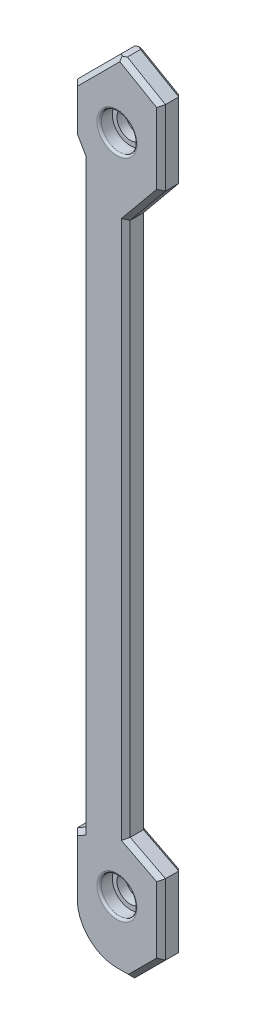
from build123d import *

# Parameters (mm, degrees)
SKETCH_1_W          = 20
SKETCH_1_H          = 180
SKETCH_1_R          = 3
EXTRUDE_1_DEPTH     = 5
SKETCH_2_R          = 4.05
CUT_EXTRUDE_1_DEPTH = 3
CHAMFER_1_SIZE      = 10
CHAMFER_2_SIZE      = 5
CHAMFER_2_SIZE2     = 8.660254038
CUT_EXTRUDE_2_DEPTH = 10
FILLET_1_R          = 10
CHAMFER_3_SIZE      = 7
CHAMFER_5_SIZE      = 1
CUT_EXTRUDE_3_DEPTH = 10
CHAMFER_6_SIZE      = 1
FILLET_2_R          = 0.5
FILLET_3_R          = 0.5


with BuildPart() as part:
    # 草图1 → 凸台-拉伸1 (new body)
    with BuildSketch(Plane.XY):
        Rectangle(SKETCH_1_W, SKETCH_1_H)
        with Locations((0, -75)):
            Circle(SKETCH_1_R, mode=Mode.SUBTRACT)
        with Locations((0, 75)):
            Circle(SKETCH_1_R, mode=Mode.SUBTRACT)
    extrude(amount=EXTRUDE_1_DEPTH)

    # 草图2 → 切除-拉伸1 (cut)
    with BuildSketch(Plane.XY.offset(5)):
        with Locations((0, 75)):
            Circle(SKETCH_2_R)
        with Locations((0, -75)):
            Circle(SKETCH_2_R)
    extrude(amount=-CUT_EXTRUDE_1_DEPTH, mode=Mode.SUBTRACT)

    # 倒角1
    chamfer_1_edges = [part.edges().sort_by_distance(p)[0] for p in [
        (-10, 90, 2.5),
    ]]
    chamfer(chamfer_1_edges, length=CHAMFER_1_SIZE)

    # 倒角2
    chamfer_2_edges = [part.edges().sort_by_distance(p)[0] for p in [
        (10, 90, 2.5),
    ]]
    chamfer_2_side = [part.faces().sort_by_distance(p)[0] for p in [
        (10, 0, 2.5),
    ]]
    chamfer(chamfer_2_edges, length=CHAMFER_2_SIZE, length2=CHAMFER_2_SIZE2, reference=chamfer_2_side[0])

    # 草图3 → 切除-拉伸2 (cut)
    with BuildSketch(Plane.XY.offset(5)):
        Polygon((10, 68), (2, 58.268253796), (2, -62.880981993), (10, -67), align=None)
    extrude(amount=-CUT_EXTRUDE_2_DEPTH, mode=Mode.SUBTRACT)

    # 圆角1
    fillet_1_edges = [part.edges().sort_by_distance(p)[0] for p in [
        (-10, -90, 2.5),
    ]]
    fillet(fillet_1_edges, radius=FILLET_1_R)

    # 倒角3
    chamfer_3_edges = [part.edges().sort_by_distance(p)[0] for p in [
        (10, -90, 2.5),
    ]]
    chamfer(chamfer_3_edges, length=CHAMFER_3_SIZE)

    # 倒角5
    # the kernel refuses this chamfer: 1 mm, written as the material it takes off along each edge
    with BuildSketch(Plane(origin=(-11.81845448, 78.18154552, 0), x_dir=(0.7068394360706736, -0.7068394360706736, -0.02749587661058609), z_dir=(0.7071067811865476, 0.7071067811865476, 0)), Plane(origin=(-11.81845448, 78.18154552, 5), x_dir=(-0.019442520806012064, 0.019442520806012064, -0.9996219169112968), z_dir=(0.7071067811865476, 0.7071067811865476, 0))) as chamfer_5_piece_1:
        Polygon((CHAMFER_5_SIZE * 0.999621916911, -CHAMFER_5_SIZE * 0.0274958766106), (-CHAMFER_5_SIZE * 0.0274958766106, -CHAMFER_5_SIZE * 0.999621916911), (0, 0), align=None)
    extrude(amount=19.2855016, mode=Mode.SUBTRACT)
    with BuildSketch(Plane(origin=(12.227142798, 83.714158506, 0), x_dir=(-0.49981095845564655, -0.8656979742248815, -0.02749587661058648), z_dir=(-0.8660254037844397, 0.49999999999999817, 0)), Plane(origin=(12.227142798, 83.714158506, 5), x_dir=(0.013747938305290464, 0.02381212764408557, -0.999621916911297), z_dir=(-0.8660254037844397, 0.49999999999999817, 0))) as chamfer_5_piece_2:
        Polygon((CHAMFER_5_SIZE * 0.999621916911, CHAMFER_5_SIZE * 0.0274958766106), (-CHAMFER_5_SIZE * 0.0274958766106, CHAMFER_5_SIZE * 0.999621916911), (0, 0), align=None)
    extrude(amount=15.143365976, mode=Mode.SUBTRACT)
    with BuildSketch(Plane(origin=(1.18154552, -91.81845448, 0), x_dir=(-0.7068394360706736, 0.7068394360706735, -0.027495876610586254), z_dir=(0.7071067811865476, 0.7071067811865476, 0)), Plane(origin=(1.18154552, -91.81845448, 5), x_dir=(0.01944252080601271, -0.01944252080601271, -0.9996219169112968), z_dir=(0.7071067811865476, 0.7071067811865476, 0))) as chamfer_5_piece_3:
        Polygon((CHAMFER_5_SIZE * 0.999621916911, CHAMFER_5_SIZE * 0.0274958766106), (-CHAMFER_5_SIZE * 0.0274958766106, CHAMFER_5_SIZE * 0.999621916911), (0, 0), align=None)
    extrude(amount=15.042860913, mode=Mode.SUBTRACT)
    with BuildSketch(Plane(origin=(10, -85.571682988, 0), x_dir=(-0.9996219169112968, 0, -0.02749587661058639), z_dir=(0, 1, 0)), Plane(origin=(10, -85.571682988, 5), x_dir=(0.027495876610585623, 0, -0.9996219169112968), z_dir=(0, 1, 0))) as chamfer_5_piece_4:
        Polygon((CHAMFER_5_SIZE * 0.999621916911, CHAMFER_5_SIZE * 0.0274958766106), (-CHAMFER_5_SIZE * 0.0274958766106, CHAMFER_5_SIZE * 0.999621916911), (0, 0), align=None)
    extrude(amount=21.143365976, mode=Mode.SUBTRACT)
    with BuildSketch(Plane(origin=(-0.286415982, -61.703758417, 0), x_dir=(-0.4575908043726023, -0.8887376623745898, -0.027495876610586185), z_dir=(0.8890738061453024, -0.4577638771531731, 0))) as chamfer_5_piece_5_section:
        Polygon((CHAMFER_5_SIZE * 0.999621916911, -CHAMFER_5_SIZE * 0.0274958766106), (-CHAMFER_5_SIZE * 0.0274958766106, -CHAMFER_5_SIZE * 0.999621916911), (0, 0), align=None)
    chamfer_5_piece_5 = extrude(amount=14.141494078, mode=Mode.PRIVATE)
    chamfer_5_piece_5 = split(chamfer_5_piece_5, bisect_by=Plane(origin=(2, -65.858290637, 0.331326909), z_dir=(1, 0, 0)), keep=Keep.TOP, mode=Mode.PRIVATE)
    add(chamfer_5_piece_5, mode=Mode.SUBTRACT)
    with BuildSketch(Plane(origin=(10, 65.428317012, 0), x_dir=(-0.9996219169112968, 0, -0.02749587661058639), z_dir=(0, 1, 0)), Plane(origin=(10, 65.428317012, 5), x_dir=(0.027495876610585623, 0, -0.9996219169112968), z_dir=(0, 1, 0))) as chamfer_5_piece_6:
        Polygon((CHAMFER_5_SIZE * 0.999621916911, CHAMFER_5_SIZE * 0.0274958766106), (-CHAMFER_5_SIZE * 0.0274958766106, CHAMFER_5_SIZE * 0.999621916911), (0, 0), align=None)
    extrude(amount=22.143365976, mode=Mode.SUBTRACT)
    with BuildSketch(Plane(origin=(11.633087807, 69.986599508, 0), x_dir=(-0.7721979799806099, 0.6347867803312237, -0.02749587661058653), z_dir=(-0.6350268732528727, -0.7724900454029683, 0))) as chamfer_5_piece_7_section:
        Polygon((CHAMFER_5_SIZE * 0.999621916911, -CHAMFER_5_SIZE * 0.0274958766106), (-CHAMFER_5_SIZE * 0.0274958766106, -CHAMFER_5_SIZE * 0.999621916911), (0, 0), align=None)
    chamfer_5_piece_7 = extrude(amount=17.741258029, mode=Mode.PRIVATE)
    chamfer_5_piece_7 = split(chamfer_5_piece_7, bisect_by=Plane(origin=(2, 64.486030302, 0.332589974), z_dir=(1, 0, 0)), keep=Keep.TOP, mode=Mode.PRIVATE)
    add(chamfer_5_piece_7, mode=Mode.SUBTRACT)
    with BuildSketch(Plane(origin=(2, 60.839936784, 0), x_dir=(-0.9996219169112968, 0, -0.027495876610586365), z_dir=(0, -1, 0))) as chamfer_5_piece_8_section:
        Polygon((CHAMFER_5_SIZE * 0.999621916911, -CHAMFER_5_SIZE * 0.0274958766106), (-CHAMFER_5_SIZE * 0.0274958766106, -CHAMFER_5_SIZE * 0.999621916911), (0, 0), align=None)
    chamfer_5_piece_8 = extrude(amount=126.292601765, mode=Mode.PRIVATE)
    chamfer_5_piece_8 = split(chamfer_5_piece_8, bisect_by=Plane(origin=(-22.866025016, -50.078031392, 0.330281086), z_dir=(0.4577638771531731, 0.8890738061453024, 0)), keep=Keep.TOP, mode=Mode.PRIVATE)
    chamfer_5_piece_8 = split(chamfer_5_piece_8, bisect_by=Plane(origin=(-27.904215912, 21.890723836, 0.330281086), z_dir=(0.7724900454029683, -0.6350268732528727, 0)), keep=Keep.TOP, mode=Mode.PRIVATE)
    add(chamfer_5_piece_8, mode=Mode.SUBTRACT)
    with BuildSketch(Plane(origin=(-0.286415982, -61.703758417, 5), x_dir=(0.012586619082987256, 0.024445863671475603, -0.9996219169112968), z_dir=(0.8890738061453024, -0.4577638771531731, 0))) as chamfer_5_piece_9_section:
        Polygon((CHAMFER_5_SIZE * 0.999621916911, -CHAMFER_5_SIZE * 0.0274958766106), (-CHAMFER_5_SIZE * 0.0274958766106, -CHAMFER_5_SIZE * 0.999621916911), (0, 0), align=None)
    chamfer_5_piece_9 = extrude(amount=14.141494078, mode=Mode.PRIVATE)
    chamfer_5_piece_9 = split(chamfer_5_piece_9, bisect_by=Plane(origin=(2, -65.858290637, 4.668673091), z_dir=(1, 0, 0)), keep=Keep.TOP, mode=Mode.PRIVATE)
    add(chamfer_5_piece_9, mode=Mode.SUBTRACT)
    with BuildSketch(Plane(origin=(11.633087807, 69.986599508, 5), x_dir=(0.02124029097130686, -0.017460620551367937, -0.9996219169112968), z_dir=(-0.6350268732528727, -0.7724900454029683, 0))) as chamfer_5_piece_10_section:
        Polygon((CHAMFER_5_SIZE * 0.999621916911, -CHAMFER_5_SIZE * 0.0274958766106), (-CHAMFER_5_SIZE * 0.0274958766106, -CHAMFER_5_SIZE * 0.999621916911), (0, 0), align=None)
    chamfer_5_piece_10 = extrude(amount=17.741258029, mode=Mode.PRIVATE)
    chamfer_5_piece_10 = split(chamfer_5_piece_10, bisect_by=Plane(origin=(2, 64.486030302, 4.667410026), z_dir=(1, 0, 0)), keep=Keep.TOP, mode=Mode.PRIVATE)
    add(chamfer_5_piece_10, mode=Mode.SUBTRACT)
    with BuildSketch(Plane(origin=(2, 60.839936784, 5), x_dir=(0.027495876610586487, 0, -0.9996219169112968), z_dir=(0, -1, 0))) as chamfer_5_piece_11_section:
        Polygon((CHAMFER_5_SIZE * 0.999621916911, -CHAMFER_5_SIZE * 0.0274958766106), (-CHAMFER_5_SIZE * 0.0274958766106, -CHAMFER_5_SIZE * 0.999621916911), (0, 0), align=None)
    chamfer_5_piece_11 = extrude(amount=126.292601765, mode=Mode.PRIVATE)
    chamfer_5_piece_11 = split(chamfer_5_piece_11, bisect_by=Plane(origin=(-22.866025016, -50.078031392, 4.669718914), z_dir=(0.4577638771531731, 0.8890738061453024, 0)), keep=Keep.TOP, mode=Mode.PRIVATE)
    chamfer_5_piece_11 = split(chamfer_5_piece_11, bisect_by=Plane(origin=(-27.904215912, 21.890723836, 4.669718914), z_dir=(0.7724900454029683, -0.6350268732528727, 0)), keep=Keep.TOP, mode=Mode.PRIVATE)
    add(chamfer_5_piece_11, mode=Mode.SUBTRACT)
    with BuildSketch(Plane(origin=(-0.286415982, -61.703758417, 0), x_dir=(-0.4575908043726023, -0.8887376623745898, -0.027495876610586185), z_dir=(0.8890738061453024, -0.4577638771531731, 0))) as chamfer_5_piece_12a_section:
        Polygon((CHAMFER_5_SIZE * 0.999621916911, -CHAMFER_5_SIZE * 0.0274958766106), (-CHAMFER_5_SIZE * 0.0274958766106, -CHAMFER_5_SIZE * 0.999621916911), (0, 0), align=None)
    chamfer_5_piece_12a = extrude(amount=14.141494078, mode=Mode.PRIVATE)
    chamfer_5_piece_12a = split(chamfer_5_piece_12a, bisect_by=Plane(origin=(2, -62.636454887, 0.323417731), z_dir=(-1, 0, 0)), keep=Keep.TOP, mode=Mode.PRIVATE)
    with BuildSketch(Plane(origin=(2, 60.839936784, 0), x_dir=(-0.9996219169112968, 0, -0.027495876610586365), z_dir=(0, -1, 0))) as chamfer_5_piece_12b_section:
        Polygon((CHAMFER_5_SIZE * 0.999621916911, -CHAMFER_5_SIZE * 0.0274958766106), (-CHAMFER_5_SIZE * 0.0274958766106, -CHAMFER_5_SIZE * 0.999621916911), (0, 0), align=None)
    chamfer_5_piece_12b = extrude(amount=126.292601765, mode=Mode.PRIVATE)
    chamfer_5_piece_12b = split(chamfer_5_piece_12b, bisect_by=Plane(origin=(2.217402645, -62.992917669, 0.323417731), z_dir=(-0.4577638771531731, -0.8890738061453024, 0)), keep=Keep.TOP, mode=Mode.PRIVATE)
    chamfer_5_piece_12 = chamfer_5_piece_12a & chamfer_5_piece_12b
    add(chamfer_5_piece_12, mode=Mode.SUBTRACT)
    with BuildSketch(Plane(origin=(2, 60.839936784, 0), x_dir=(-0.9996219169112968, 0, -0.027495876610586365), z_dir=(0, -1, 0))) as chamfer_5_piece_13a_section:
        Polygon((CHAMFER_5_SIZE * 0.999621916911, -CHAMFER_5_SIZE * 0.0274958766106), (-CHAMFER_5_SIZE * 0.0274958766106, -CHAMFER_5_SIZE * 0.999621916911), (0, 0), align=None)
    chamfer_5_piece_13a = extrude(amount=126.292601765, mode=Mode.PRIVATE)
    chamfer_5_piece_13a = split(chamfer_5_piece_13a, bisect_by=Plane(origin=(2.381147495, 58.731907632, 0.315902133), z_dir=(-0.7724900454029683, 0.6350268732528727, 0)), keep=Keep.TOP, mode=Mode.PRIVATE)
    with BuildSketch(Plane(origin=(11.633087807, 69.986599508, 0), x_dir=(-0.7721979799806099, 0.6347867803312237, -0.02749587661058653), z_dir=(-0.6350268732528727, -0.7724900454029683, 0))) as chamfer_5_piece_13b_section:
        Polygon((CHAMFER_5_SIZE * 0.999621916911, -CHAMFER_5_SIZE * 0.0274958766106), (-CHAMFER_5_SIZE * 0.0274958766106, -CHAMFER_5_SIZE * 0.999621916911), (0, 0), align=None)
    chamfer_5_piece_13b = extrude(amount=17.741258029, mode=Mode.PRIVATE)
    chamfer_5_piece_13b = split(chamfer_5_piece_13b, bisect_by=Plane(origin=(2, 57.668046921, 0.315902133), z_dir=(-1, 0, 0)), keep=Keep.TOP, mode=Mode.PRIVATE)
    chamfer_5_piece_13 = chamfer_5_piece_13a & chamfer_5_piece_13b
    add(chamfer_5_piece_13, mode=Mode.SUBTRACT)
    with BuildSketch(Plane(origin=(-0.286415982, -61.703758417, 5), x_dir=(0.012586619082987256, 0.024445863671475603, -0.9996219169112968), z_dir=(0.8890738061453024, -0.4577638771531731, 0))) as chamfer_5_piece_14a_section:
        Polygon((CHAMFER_5_SIZE * 0.999621916911, -CHAMFER_5_SIZE * 0.0274958766106), (-CHAMFER_5_SIZE * 0.0274958766106, -CHAMFER_5_SIZE * 0.999621916911), (0, 0), align=None)
    chamfer_5_piece_14a = extrude(amount=14.141494078, mode=Mode.PRIVATE)
    chamfer_5_piece_14a = split(chamfer_5_piece_14a, bisect_by=Plane(origin=(2, -62.636454887, 4.676582269), z_dir=(-1, 0, 0)), keep=Keep.TOP, mode=Mode.PRIVATE)
    with BuildSketch(Plane(origin=(2, 60.839936784, 5), x_dir=(0.027495876610586487, 0, -0.9996219169112968), z_dir=(0, -1, 0))) as chamfer_5_piece_14b_section:
        Polygon((CHAMFER_5_SIZE * 0.999621916911, -CHAMFER_5_SIZE * 0.0274958766106), (-CHAMFER_5_SIZE * 0.0274958766106, -CHAMFER_5_SIZE * 0.999621916911), (0, 0), align=None)
    chamfer_5_piece_14b = extrude(amount=126.292601765, mode=Mode.PRIVATE)
    chamfer_5_piece_14b = split(chamfer_5_piece_14b, bisect_by=Plane(origin=(2.217402645, -62.992917669, 4.676582269), z_dir=(-0.4577638771531731, -0.8890738061453024, 0)), keep=Keep.TOP, mode=Mode.PRIVATE)
    chamfer_5_piece_14 = chamfer_5_piece_14a & chamfer_5_piece_14b
    add(chamfer_5_piece_14, mode=Mode.SUBTRACT)
    with BuildSketch(Plane(origin=(2, 60.839936784, 5), x_dir=(0.027495876610586487, 0, -0.9996219169112968), z_dir=(0, -1, 0))) as chamfer_5_piece_15a_section:
        Polygon((CHAMFER_5_SIZE * 0.999621916911, -CHAMFER_5_SIZE * 0.0274958766106), (-CHAMFER_5_SIZE * 0.0274958766106, -CHAMFER_5_SIZE * 0.999621916911), (0, 0), align=None)
    chamfer_5_piece_15a = extrude(amount=126.292601765, mode=Mode.PRIVATE)
    chamfer_5_piece_15a = split(chamfer_5_piece_15a, bisect_by=Plane(origin=(2.381147495, 58.731907632, 4.684097867), z_dir=(-0.7724900454029683, 0.6350268732528727, 0)), keep=Keep.TOP, mode=Mode.PRIVATE)
    with BuildSketch(Plane(origin=(11.633087807, 69.986599508, 5), x_dir=(0.02124029097130686, -0.017460620551367937, -0.9996219169112968), z_dir=(-0.6350268732528727, -0.7724900454029683, 0))) as chamfer_5_piece_15b_section:
        Polygon((CHAMFER_5_SIZE * 0.999621916911, -CHAMFER_5_SIZE * 0.0274958766106), (-CHAMFER_5_SIZE * 0.0274958766106, -CHAMFER_5_SIZE * 0.999621916911), (0, 0), align=None)
    chamfer_5_piece_15b = extrude(amount=17.741258029, mode=Mode.PRIVATE)
    chamfer_5_piece_15b = split(chamfer_5_piece_15b, bisect_by=Plane(origin=(2, 57.668046921, 4.684097867), z_dir=(-1, 0, 0)), keep=Keep.TOP, mode=Mode.PRIVATE)
    chamfer_5_piece_15 = chamfer_5_piece_15a & chamfer_5_piece_15b
    add(chamfer_5_piece_15, mode=Mode.SUBTRACT)

    # 草图4 → 切除-拉伸3 (cut)
    with BuildSketch(Plane.XY.offset(5)):
        Polygon((-10, 70), (-8, 66.535898385), (-8, -65.845299462), (-10, -67), align=None)
    extrude(amount=-CUT_EXTRUDE_3_DEPTH, mode=Mode.SUBTRACT)

    # 倒角6
    chamfer_6_edges = [part.edges().sort_by_distance(p)[0] for p in [
        (-9, -66.422649731, 0),
        (-10, 74.292893219, 0),
        (-9, 68.267949192, 0),
        (-8, 0.345299462, 0),
        (0.792893219, -90, 0),
        (-10, -73.5, 0),
        (-7.071067812, -87.071067812, 0),
        (0.792893219, -90, 5),
        (-7.071067812, -87.071067812, 5),
        (-10, 74.292893219, 5),
        (-9, 68.267949192, 5),
        (-8, 0.345299462, 5),
        (-9, -66.422649731, 5),
        (-10, -73.5, 5),
    ]]
    chamfer(chamfer_6_edges, length=CHAMFER_6_SIZE)

    # 圆角2
    fillet_2_edges = [part.edges().sort_by_distance(p)[0] for p in [
        (-4.05, -75, 5),
    ]]
    fillet(fillet_2_edges, radius=FILLET_2_R)

    # 圆角3
    fillet_3_edges = [part.edges().sort_by_distance(p)[0] for p in [
        (-4.05, 75, 5),
    ]]
    fillet(fillet_3_edges, radius=FILLET_3_R)


solid = part.part
